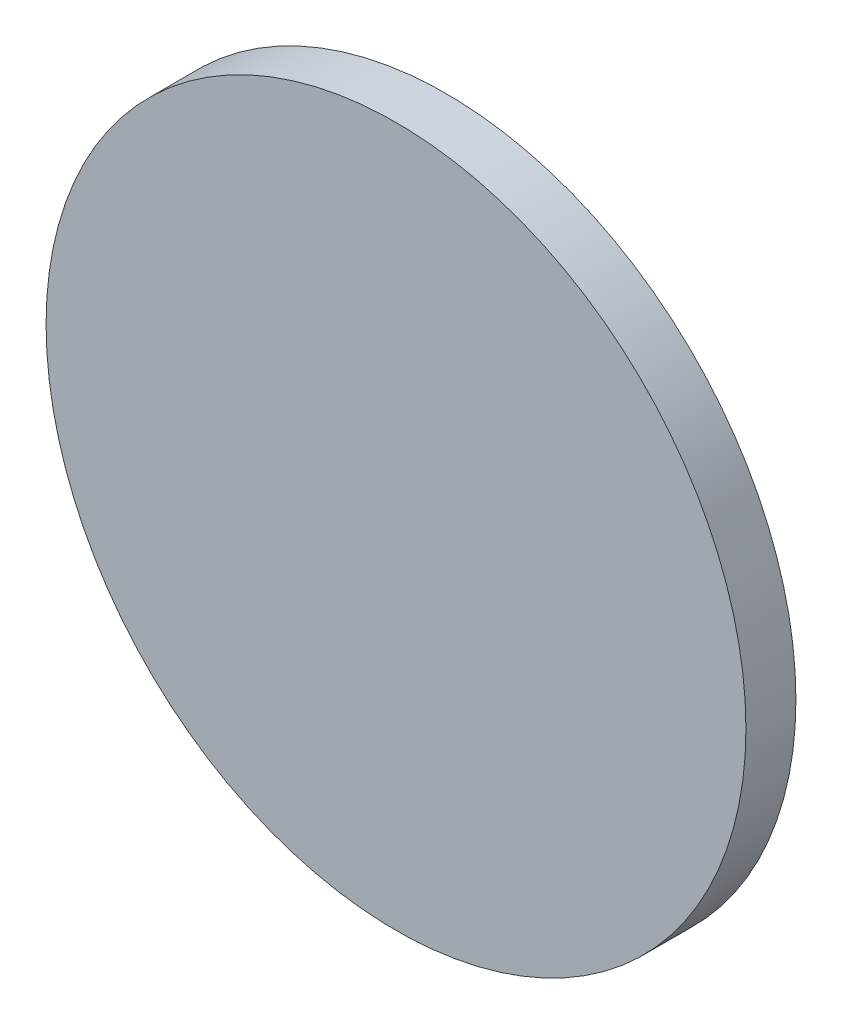
from build123d import *

# Parameters (mm, degrees)
SKETCH1_R           = 22.225
BOSS_EXTRUDE1_DEPTH = 3.175


with BuildPart() as part:
    # Sketch1 → Boss-Extrude1 (new body)
    with BuildSketch(Plane.XY):
        Circle(SKETCH1_R)
    extrude(amount=BOSS_EXTRUDE1_DEPTH)


solid = part.part
